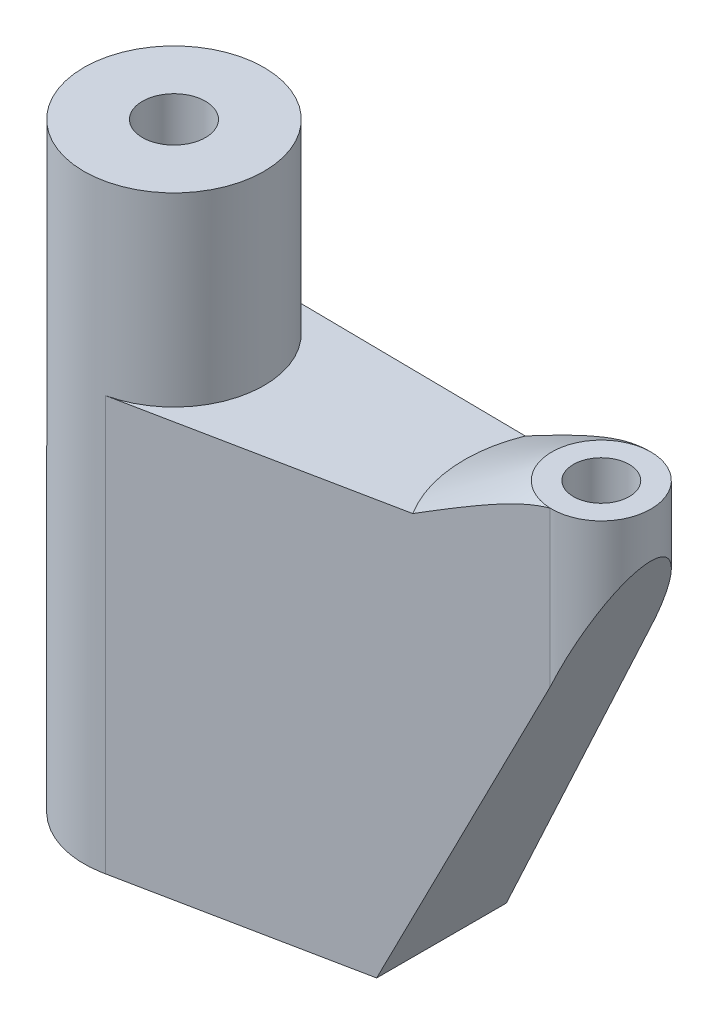
from build123d import *

# Parameters (mm, degrees)
SKETCH1_R               = 5
SKETCH1_R_2             = 1.75
BOSS_EXTRUDE1_DEPTH     = 33.3
SKETCH2_R               = 2.75
BOSS_EXTRUDE2_DEPTH     = 25.8
BOSS_EXTRUDE3_DEPTH     = 23
SKETCH3_R               = 1.55
CUT_EXTRUDE1_DEPTH      = 3
CUT_EXTRUDE2_DEPTH      = 42.631243075
CUT_EXTRUDE2_DEPTH_BACK = 42.631243075
CHAMFER3_SIZE2          = 2.8
CHAMFER3_SIZE           = 4.849742261


with BuildPart() as part:
    # Sketch1 → Boss-Extrude1 (new body)
    with BuildSketch(Plane(origin=(0, 0, 0), x_dir=(1, 0, 0), z_dir=(0, 1, 0))):
        with Locations(Location((0, 0, 0), (0, 0, 270))):
            Circle(SKETCH1_R)
        with Locations(Location((0, 0, 0), (0, 0, 270))):
            Circle(SKETCH1_R_2, mode=Mode.SUBTRACT)
    extrude(amount=BOSS_EXTRUDE1_DEPTH)



with BuildPart() as body_2:
    # Sketch2 → Boss-Extrude2 (new body)
    with BuildSketch(Plane(origin=(0, 0, 0), x_dir=(1, 0, 0), z_dir=(0, 1, 0))):
        with Locations(Location((21.73, 2, 0), (0, 0, 90))):
            Circle(SKETCH2_R)
    extrude(amount=BOSS_EXTRUDE2_DEPTH)


with BuildPart() as part_1:
    add(part.part)

    add(body_2.part)  # Boss-Extrude3 merges body 2
    # Sketch4 → Boss-Extrude3 (add)
    with BuildSketch(Plane.XZ):
        Polygon((21.637816883, 0.748454524), (0.891372697, 4.919903934), (2.67017604, 0), (0.014392721, -4.999979285), (21.637816883, -4.748454524), align=None)
    extrude(amount=-BOSS_EXTRUDE3_DEPTH)

    # Sketch3 → Cut-Extrude1 (cut)
    with BuildSketch(Plane(origin=(0, 25.8, 0), x_dir=(1, 0, 0), z_dir=(0, 1, 0))):
        with Locations(Location((21.73, 2, 0), (0, 0, 270))):
            Circle(SKETCH3_R)
    extrude(amount=-CUT_EXTRUDE1_DEPTH, mode=Mode.SUBTRACT)

    # Sketch5 → Cut-Extrude2 (cut, two sides: drawn at the far end of the back side and taken through both)
    with BuildSketch(Plane.XY.offset(-CUT_EXTRUDE2_DEPTH_BACK)):
        Polygon((24.48, 23.3), (12.590189784, -2.197780292), (24.48, 0), (24.48, 11.782113075), align=None)
    extrude(amount=CUT_EXTRUDE2_DEPTH + CUT_EXTRUDE2_DEPTH_BACK, mode=Mode.SUBTRACT)

    # Chamfer3
    chamfer3_edges = [part_1.edges().sort_by_distance(p)[0] for p in [
        (18.98, 23, -2),
    ]]
    chamfer3_side = [part_1.faces().sort_by_distance(p)[0] for p in [
        (18.924, 23, -2),
    ]]
    chamfer(chamfer3_edges, length=CHAMFER3_SIZE - 0.0001, length2=CHAMFER3_SIZE2 - 0.0001, reference=chamfer3_side[0])  # a hair under: the kernel refuses the full size


solid = part_1.part
